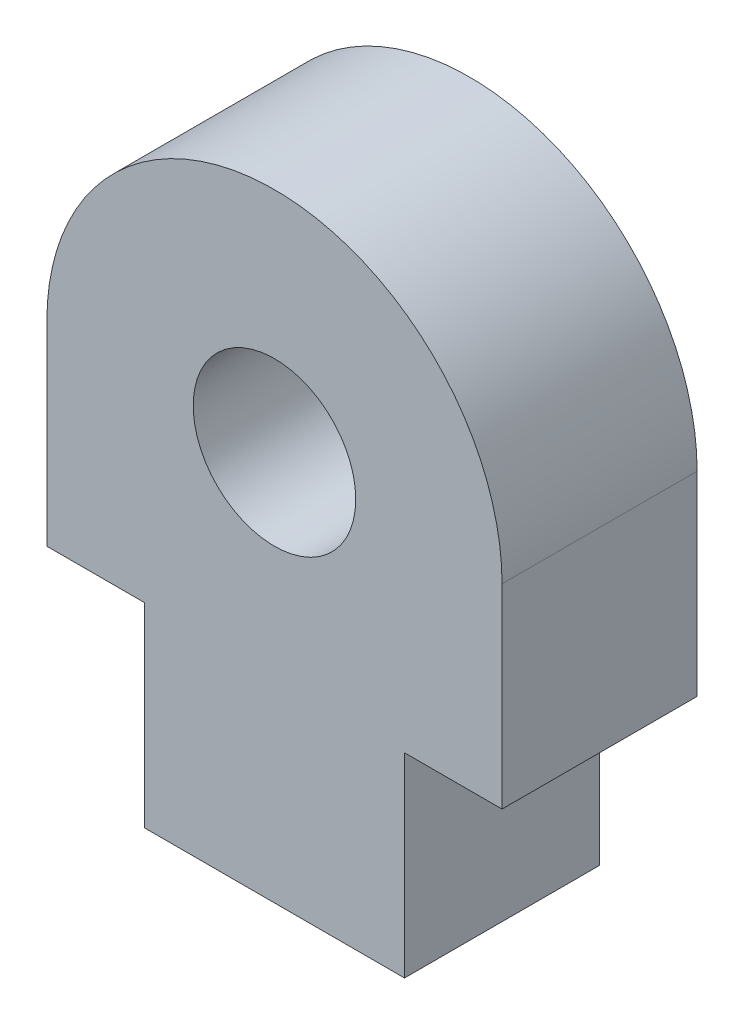
from build123d import *

# Parameters (mm, degrees)
SKETCH1_R           = 1.25
BOSS_EXTRUDE1_DEPTH = 3


with BuildPart() as part:
    # Sketch1 → Boss-Extrude1 (new body)
    with BuildSketch(Plane.XY):
        with BuildLine():
            Line((-3.5, 0), (-3.5, -3))
            Line((-3.5, -3), (-2, -3))
            Line((-2, -3), (-2, -6))
            Line((-2, -6), (2, -6))
            Line((2, -6), (2, -3))
            Line((2, -3), (3.5, -3))
            Line((3.5, -3), (3.5, 0))
            ThreePointArc((3.5, 0), (0, 3.5), (-3.5, 0))
        make_face()
        Circle(SKETCH1_R, mode=Mode.SUBTRACT)
    extrude(amount=BOSS_EXTRUDE1_DEPTH)


solid = part.part
